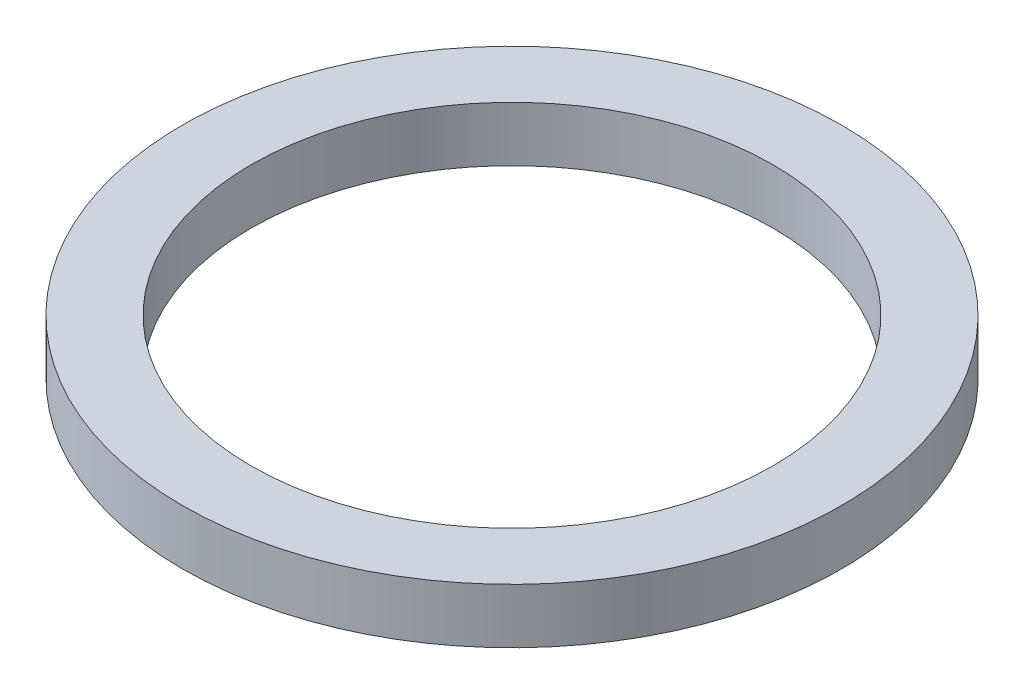
from build123d import *

# Parameters (mm, degrees)
SKETCH1_R           = 60
SKETCH1_R_2         = 47.5
BOSS_EXTRUDE1_DEPTH = 10


with BuildPart() as part:
    # Sketch1 → Boss-Extrude1 (new body)
    with BuildSketch(Plane(origin=(0, 0, 0), x_dir=(1, 0, 0), z_dir=(0, 1, 0))):
        Circle(SKETCH1_R)
        Circle(SKETCH1_R_2, mode=Mode.SUBTRACT)
    extrude(amount=BOSS_EXTRUDE1_DEPTH)


solid = part.part
